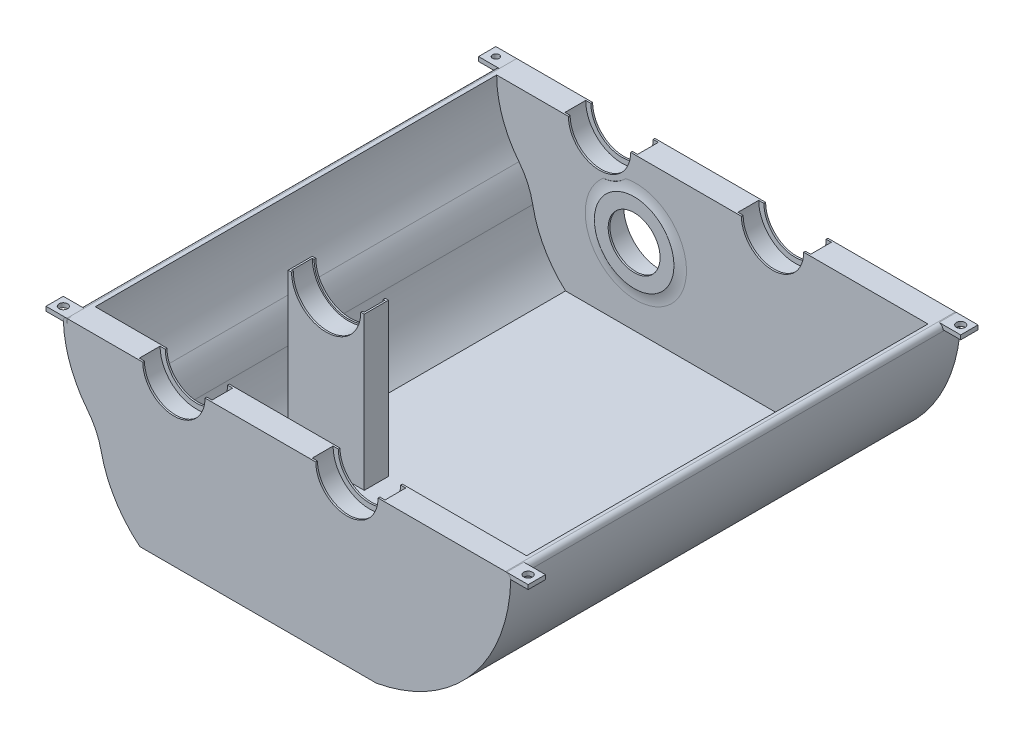
from build123d import *

# Parameters (mm, degrees)
BOSS_EXTRUDE2_DEPTH     = 260
BOSS_EXTRUDE3_DEPTH     = 14
SKETCH32_R              = 2.5
BOSS_EXTRUDE13_DEPTH    = 2.5
BOSS_EXTRUDE13_2_DEPTH  = 2.5
BOSS_EXTRUDE13_3_DEPTH  = 2.5
SKETCH32_R_2            = 1.89867991
BOSS_EXTRUDE13_4_DEPTH  = 2.5
SKETCH6_R               = 21.05
CUT_EXTRUDE1_DEPTH      = 325.000361639
BOSS_EXTRUDE4_START     = -14
BOSS_EXTRUDE4_DEPTH     = 14
BOSS_EXTRUDE5_DEPTH     = 88.2
CUT_EXTRUDE4_DEPTH      = 259.766756641
CUT_EXTRUDE4_DEPTH_BACK = 259.766756641
SKETCH16_R              = 21
SKETCH19_W              = 44
SKETCH19_H              = 1
BOSS_EXTRUDE9_DEPTH     = 40
SKETCH21_W              = 42
SKETCH21_H              = 1
BOSS_EXTRUDE10_DEPTH    = 40
CUT_EXTRUDE5_DEPTH      = 250.680264223
CUT_EXTRUDE5_DEPTH_BACK = 250.680264223
SKETCH22_R              = 20
FILLET7_R               = 40
FILLET8_R               = 40
SKETCH26_R              = 23
SKETCH26_R_2            = 15
BOSS_EXTRUDE11_DEPTH    = 1
FILLET9_R               = 20
SKETCH27_W              = 142
SKETCH27_H              = 1
BOSS_EXTRUDE12_DEPTH    = 25
CUT_EXTRUDE7_DEPTH      = 325.000361738
CUT_EXTRUDE7_DEPTH_BACK = 325.000361738
SKETCH28_R              = 18
SKETCH31_R              = 21.05
CUT_EXTRUDE8_DEPTH      = 14
FILLET12_R              = 2
FILLET15_R              = 3


with BuildPart() as part:
    # Sketch4 → Boss-Extrude2 (new body)
    with BuildSketch(Plane.XY):
        with BuildLine():
            Line((0, -55.142064338), (95.994056336, -55.142064338))
            ThreePointArc((95.994056336, -55.142064338), (148.262119718, -24.132944056), (168.822257546, 33.057935662))
            Line((168.822257546, 33.057935662), (173.736676904, 33.057935662))
            ThreePointArc((173.736676904, 33.057935662), (151.749564862, -27.625989418), (95.994056336, -60.142064338))
            Line((95.994056336, -60.142064338), (-40.661605406, -60.142064338))
            ThreePointArc((-40.661605406, -60.142064338), (-57.355877726, -39.530317849), (-64.334580903, -13.940465884))
            ThreePointArc((-64.334580903, -13.940465884), (-79.553439665, 7.401935326), (-84.927581292, 33.057935662))
            Line((-84.927581292, 33.057935662), (-80.457592966, 33.057935662))
            ThreePointArc((-80.457592966, 33.057935662), (-75.277345345, 8.785005398), (-60.639261472, -11.25836282))
            ThreePointArc((-60.639261472, -11.25836282), (-55.198833523, -35.270831357), (-40.661605406, -55.142064338))
            Line((-40.661605406, -55.142064338), (0, -55.142064338))
        make_face()
    extrude(amount=BOSS_EXTRUDE2_DEPTH)

    # Sketch5 → Boss-Extrude3 (add)
    with BuildSketch(Plane(origin=(0, 0, 0), x_dir=(-1, 0, 0), z_dir=(0, 0, -1))):
        with BuildLine():
            ThreePointArc((-58, 33.057935662), (-79, 12.057935662), (-100, 33.057935662))
            Line((-100, 33.057935662), (-168.822257546, 33.057935662))
            ThreePointArc((-168.822257546, 33.057935662), (-148.262119718, -24.132944056), (-95.994056336, -55.142064338))
            Line((-95.994056336, -55.142064338), (40.661605406, -55.142064338))
            ThreePointArc((40.661605406, -55.142064338), (55.198833523, -35.270831357), (60.639261472, -11.25836282))
            ThreePointArc((60.639261472, -11.25836282), (69.157100692, -1.81467557), (75.471736637, 9.224445171))
            ThreePointArc((75.471736637, 9.224445171), (79.197782202, 20.883227942), (80.457592966, 33.057935662))
            Line((80.457592966, 33.057935662), (42, 33.057935662))
            ThreePointArc((42, 33.057935662), (21, 12.057935662), (0, 33.057935662))
            Line((0, 33.057935662), (-58, 33.057935662))
        make_face()
    extrude(amount=-BOSS_EXTRUDE3_DEPTH)

    # Sketch6 → Cut-Extrude1 (cut, through all)
    with BuildSketch(Plane(origin=(0, 0, 0), x_dir=(-1, 0, 0), z_dir=(0, 0, -1))):
        with Locations((0, -10.142064338)):
            Circle(SKETCH6_R)
    extrude(amount=-CUT_EXTRUDE1_DEPTH, mode=Mode.SUBTRACT)

    # Sketch8 → Boss-Extrude4 (add)
    with BuildSketch(Plane.XY.offset(260).offset(BOSS_EXTRUDE4_START)):
        with BuildLine():
            Line((-40.446345249, -56.420444517), (95.994056336, -55.142064338))
            ThreePointArc((95.994056336, -55.142064338), (148.262119718, -24.132944056), (168.822257546, 33.057935662))
            Line((168.822257546, 33.057935662), (100, 33.057935662))
            ThreePointArc((100, 33.057935662), (79, 12.057935662), (58, 33.057935662))
            Line((58, 33.057935662), (0, 33.057935662))
            ThreePointArc((0, 33.057935662), (-21, 12.057935662), (-42, 33.057935662))
            Line((-42, 33.057935662), (-80.457592966, 33.057935662))
            ThreePointArc((-80.457592966, 33.057935662), (-75.277345345, 8.785005398), (-60.639261472, -11.25836282))
            ThreePointArc((-60.639261472, -11.25836282), (-55.357730963, -35.99225903), (-40.446345249, -56.420444517))
        make_face()
    extrude(amount=BOSS_EXTRUDE4_DEPTH)

    # Sketch9 → Boss-Extrude5 (add)
    with BuildSketch(Plane(origin=(0, -55.142064338, 0), x_dir=(1, 0, 0), z_dir=(0, 1, 0))):
        Polygon((1, -158), (-21, -158), (-43, -158), (-43, -172), (1, -172), align=None)
    extrude(amount=BOSS_EXTRUDE5_DEPTH)

    # Sketch16 → Cut-Extrude4 (cut, two sides: drawn at the far end of the back side and taken through both)
    with BuildSketch(Plane.XY.offset(172).offset(-CUT_EXTRUDE4_DEPTH_BACK)):
        with Locations((-21, 33.057935662)):
            Circle(SKETCH16_R)
    extrude(amount=CUT_EXTRUDE4_DEPTH + CUT_EXTRUDE4_DEPTH_BACK, mode=Mode.SUBTRACT)

    # Sketch19 → Boss-Extrude9 (add)
    with BuildSketch(Plane(origin=(0, 33.057935662, 172), x_dir=(1, 0, 0), z_dir=(0, 1, 0))):
        with Locations((-21, 0.5)):
            Rectangle(SKETCH19_W, SKETCH19_H)
    extrude(amount=-BOSS_EXTRUDE9_DEPTH)

    # Sketch21 → Boss-Extrude10 (add)
    with BuildSketch(Plane(origin=(0, 33.057935662, 158), x_dir=(-1, 0, 0), z_dir=(0, -1, 0))):
        with Locations((21, -0.5)):
            Rectangle(SKETCH21_W, SKETCH21_H)
    extrude(amount=BOSS_EXTRUDE10_DEPTH)

    # Sketch22 → Cut-Extrude5 (cut, two sides: drawn at the far end of the back side and taken through both)
    with BuildSketch(Plane(origin=(0, 0, 158), x_dir=(-1, 0, 0), z_dir=(0, 0, -1)).offset(-CUT_EXTRUDE5_DEPTH_BACK)):
        with Locations((21, 33.057935662)):
            Circle(SKETCH22_R)
    extrude(amount=CUT_EXTRUDE5_DEPTH + CUT_EXTRUDE5_DEPTH_BACK, mode=Mode.SUBTRACT)

    # Fillet7
    fillet7_edges = [part.edges().sort_by_distance(p)[0] for p in [
        (-60.639261472, -11.25836282, 130),
    ]]
    fillet(fillet7_edges, radius=FILLET7_R)

    # Fillet8
    fillet8_edges = [part.edges().sort_by_distance(p)[0] for p in [
        (-64.334580903, -13.940465884, 130),
    ]]
    fillet(fillet8_edges, radius=FILLET8_R)

    # Sketch26 → Boss-Extrude11 (add)
    with BuildSketch(Plane.XY.offset(14)):
        with Locations(Location((0, -10.142064338, 0), (0, 0, 180))):
            Circle(SKETCH26_R)
        with Locations((0, -10.142064338)):
            Circle(SKETCH26_R_2, mode=Mode.SUBTRACT)
    extrude(amount=BOSS_EXTRUDE11_DEPTH)

    # Fillet9
    # the kernel refuses this fillet: 20 mm, written as the material it adds along each edge
    with BuildSketch(Plane(origin=(0, -10.142064338, 14), x_dir=(-1, 0, 0), z_dir=(0, 1, 0))) as fillet9_piece_1_section:
        with BuildLine():
            CenterArc((29.244997998, 20), FILLET9_R, 251.805127661, 18.194872339)
            Line((23, 1), (22.87510004, 0.62))
            ThreePointArc((22.87510004, 0.62), (22.6, 0.5), (22.6, 0))
            Line((22.6, 0), (23, -0.4))
            Line((23, -0.4), (29.244997998, -0.4))
            Line((29.244997998, -0.4), (29.244997998, 0))
        make_face()
    fillet9_piece_1 = revolve(axis=Axis((0, -10.142064338, 14), (0, 0, 1)), mode=Mode.PRIVATE)
    fillet9_piece_1 = fillet9_piece_1 - Plane(origin=(-21, 33.057935662, 14.160984857), x_dir=(-1, 0, 0), z_dir=(0, 0, -1)) * Cylinder(21, 117, mode=Mode.PRIVATE)
    add(fillet9_piece_1)

    # Sketch27 → Boss-Extrude12 (add)
    with BuildSketch(Plane(origin=(0, 33.057935662, 0), x_dir=(1, 0, 0), z_dir=(0, 1, 0))):
        with Locations((29, -0.5)):
            Rectangle(SKETCH27_W, SKETCH27_H)
        with Locations((29, -246.5)):
            Rectangle(SKETCH27_W, SKETCH27_H)
        with Locations((29, -13.5)):
            Rectangle(SKETCH27_W, SKETCH27_H)
        with Locations((29, -259.5)):
            Rectangle(SKETCH27_W, SKETCH27_H)
    extrude(amount=-BOSS_EXTRUDE12_DEPTH)

    # Sketch28 → Cut-Extrude7 (cut, two sides: drawn at the far end of the back side and taken through both)
    with BuildSketch(Plane.XY.offset(260).offset(-CUT_EXTRUDE7_DEPTH_BACK)):
        with Locations((-21, 33.057935662)):
            Circle(SKETCH28_R)
        with Locations((79, 33.057935662)):
            Circle(SKETCH28_R)
    extrude(amount=CUT_EXTRUDE7_DEPTH + CUT_EXTRUDE7_DEPTH_BACK, mode=Mode.SUBTRACT)

    # Sketch31 → Cut-Extrude8 (cut)
    with BuildSketch(Plane(origin=(0, 0, 0), x_dir=(-1, 0, 0), z_dir=(0, 0, -1))):
        with Locations((0, -10.142064338)):
            Circle(SKETCH31_R)
    extrude(amount=-CUT_EXTRUDE8_DEPTH, mode=Mode.SUBTRACT)

    # Fillet12
    fillet12_edges = [part.edges().sort_by_distance(p)[0] for p in [
        (-84.927581292, 33.057935662, 130),
    ]]
    fillet(fillet12_edges, radius=FILLET12_R)

    # Fillet15
    fillet15_edges = [part.edges().sort_by_distance(p)[0] for p in [
        (173.736676904, 33.057935662, 130),
    ]]
    fillet(fillet15_edges, radius=FILLET15_R)


with BuildPart() as body_2:
    # Sketch32 → Boss-Extrude13 (new body)
    with BuildSketch(Plane(origin=(0, 33.057935662, 0), x_dir=(1, 0, 0), z_dir=(0, 1, 0))):
        Polygon((173.736676904, -260), (183.736676904, -260), (183.736676904, -250), (173.736676904, -250), (171.236676904, -250), (171.236676904, -260), align=None)
        with Locations(Location((178.736676904, -255, 0), (0, 0, 270))):
            Circle(SKETCH32_R, mode=Mode.SUBTRACT)
    extrude(amount=-BOSS_EXTRUDE13_DEPTH)


with BuildPart() as body_3:
    # Sketch32 → Boss-Extrude13 2 (new body)
    with BuildSketch(Plane(origin=(0, 33.057935662, 0), x_dir=(1, 0, 0), z_dir=(0, 1, 0))):
        Polygon((173.736676904, 0), (183.736676904, 0), (183.736676904, -10), (173.736676904, -10), (171.236676904, -10), (171.236676904, 0), align=None)
        with Locations(Location((178.736676904, -5, 0), (0, 0, 270))):
            Circle(SKETCH32_R, mode=Mode.SUBTRACT)
    extrude(amount=-BOSS_EXTRUDE13_2_DEPTH)


with BuildPart() as body_4:
    # Sketch32 → Boss-Extrude13 3 (new body)
    with BuildSketch(Plane(origin=(0, 33.057935662, 0), x_dir=(1, 0, 0), z_dir=(0, 1, 0))):
        Polygon((-84.927581292, -260), (-94.927581292, -260), (-94.927581292, -250), (-84.927581292, -250), (-82.427581292, -250), (-82.427581292, -260), align=None)
        with Locations(Location((-89.927581292, -255, 0), (0, 0, 270))):
            Circle(SKETCH32_R, mode=Mode.SUBTRACT)
    extrude(amount=-BOSS_EXTRUDE13_3_DEPTH)


with BuildPart() as body_5:
    # Sketch32 → Boss-Extrude13 4 (new body)
    with BuildSketch(Plane(origin=(0, 33.057935662, 0), x_dir=(1, 0, 0), z_dir=(0, 1, 0))):
        Polygon((-84.927581292, 0), (-94.927581292, 0), (-94.927581292, -10), (-84.927581292, -10), (-82.427581292, -10), (-82.427581292, 0), align=None)
        with Locations(Location((-89.927581292, -5, 0), (0, 0, 270))):
            Circle(SKETCH32_R_2, mode=Mode.SUBTRACT)
    extrude(amount=-BOSS_EXTRUDE13_4_DEPTH)


solid = Compound([part.part, body_2.part, body_3.part, body_4.part, body_5.part])
